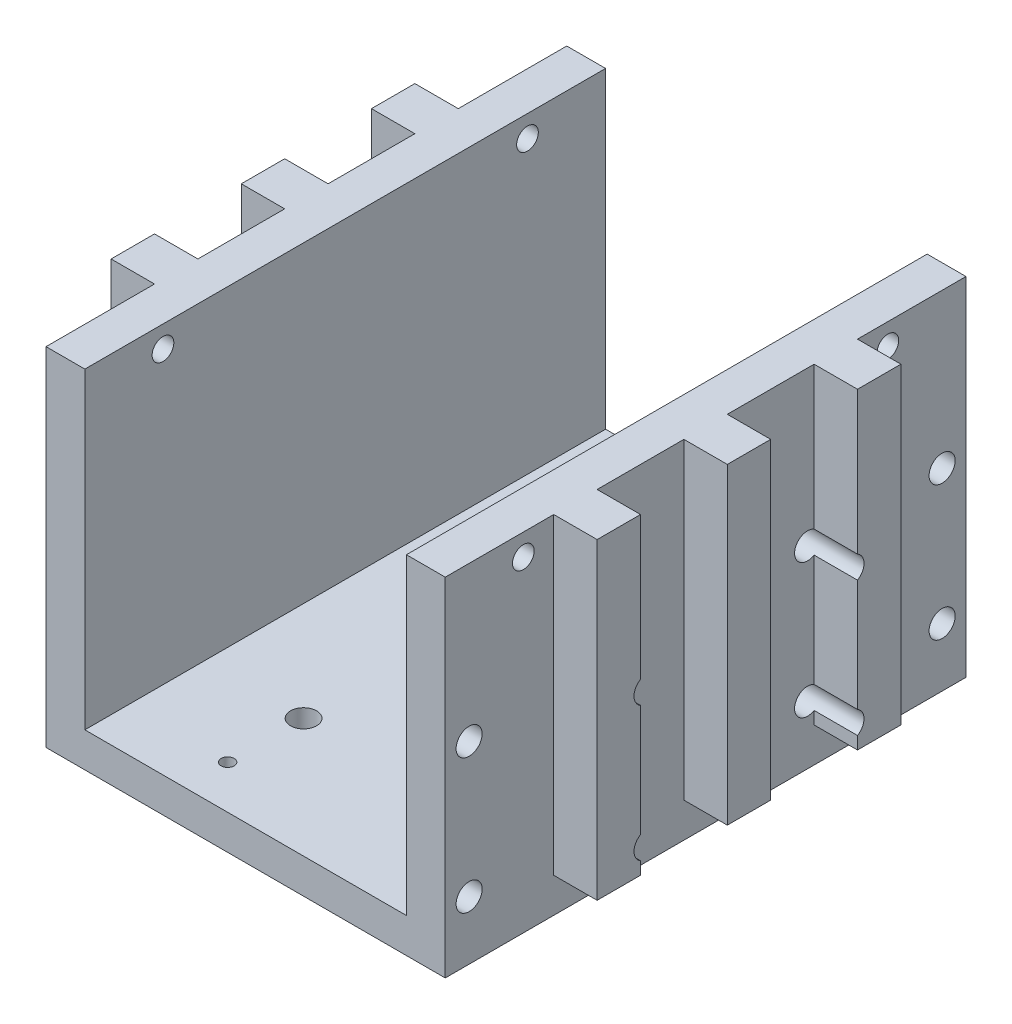
from build123d import *

# Parameters (mm, degrees)
SKETCH1_W           = 92
SKETCH1_H           = 120
BOSS_EXTRUDE1_DEPTH = 8
BOSS_EXTRUDE2_DEPTH = 72
CUT_EXTRUDE1_REACH  = 178.647
SKETCH3_R           = 3
SKETCH3_R_2         = 1.5
CUT_EXTRUDE2_REACH  = 173.635
SKETCH4_R           = 1.25
SKETCH5_R           = 3
CUT_EXTRUDE3_DEPTH  = 15
SKETCH6_R           = 2.5
CUT_EXTRUDE4_DEPTH  = 177.646539734


with BuildPart() as part:
    # Sketch1 → Boss-Extrude1 (new body)
    with BuildSketch(Plane(origin=(0, 0, 0), x_dir=(1, 0, 0), z_dir=(0, 1, 0))):
        with Locations((46, 60)):
            Rectangle(SKETCH1_W, SKETCH1_H)
    extrude(amount=BOSS_EXTRUDE1_DEPTH)

    # Sketch2 → Boss-Extrude2 (add)
    with BuildSketch(Plane(origin=(0, 8, 0), x_dir=(1, 0, 0), z_dir=(0, 1, 0))):
        Polygon((0, 120), (8.948645063, 120), (8.948645063, 0), (0, 0), (0, 25), (-10, 25), (-10, 35), (0, 35), (0, 55), (-10, 55), (-10, 65), (0, 65), (0, 85), (-10, 85), (-10, 95), (0, 95), align=None)
        Polygon((92, 55), (92, 35), (102, 35), (102, 25), (92, 25), (92, 0), (83.051354937, 0), (83.051354937, 120), (92, 120), (92, 95), (102, 95), (102, 85), (92, 85), (92, 65), (102, 65), (102, 55), align=None)
    extrude(amount=BOSS_EXTRUDE2_DEPTH)

    # Sketch3 → Cut-Extrude1 (cut, up to next)
    with BuildSketch(Plane.XZ, mode=Mode.PRIVATE) as cut_extrude1_sk1:
        with Locations((31.85, -92.5)):
            Circle(SKETCH3_R)
    cut_extrude1_tool1 = extrude(cut_extrude1_sk1.sketch, amount=-CUT_EXTRUDE1_REACH, mode=Mode.PRIVATE) & part.part
    # Sketch3 → Cut-Extrude1 (cut, up to next)
    with BuildSketch(Plane.XZ, mode=Mode.PRIVATE) as cut_extrude1_sk2:
        with Locations((31.85, -110)):
            Circle(SKETCH3_R_2)
    cut_extrude1_tool2 = extrude(cut_extrude1_sk2.sketch, amount=-CUT_EXTRUDE1_REACH, mode=Mode.PRIVATE) & part.part
    # Sketch3 → Cut-Extrude1 (cut, up to next)
    with BuildSketch(Plane.XZ, mode=Mode.PRIVATE) as cut_extrude1_sk3:
        with Locations((31.85, -10)):
            Circle(SKETCH3_R_2)
    cut_extrude1_tool3 = extrude(cut_extrude1_sk3.sketch, amount=-CUT_EXTRUDE1_REACH, mode=Mode.PRIVATE) & part.part
    # Sketch3 → Cut-Extrude1 (cut, up to next)
    with BuildSketch(Plane.XZ, mode=Mode.PRIVATE) as cut_extrude1_sk4:
        with Locations((31.85, -27.5)):
            Circle(SKETCH3_R)
    cut_extrude1_tool4 = extrude(cut_extrude1_sk4.sketch, amount=-CUT_EXTRUDE1_REACH, mode=Mode.PRIVATE) & part.part
    add(cut_extrude1_tool1.solids().sort_by_distance((31.85, 0, -92.5))[0], mode=Mode.SUBTRACT)
    add(cut_extrude1_tool2.solids().sort_by_distance((31.85, 0, -110))[0], mode=Mode.SUBTRACT)
    add(cut_extrude1_tool3.solids().sort_by_distance((31.85, 0, -10))[0], mode=Mode.SUBTRACT)
    add(cut_extrude1_tool4.solids().sort_by_distance((31.85, 0, -27.5))[0], mode=Mode.SUBTRACT)

    # Sketch4 → Cut-Extrude2 (cut, up to next)
    with BuildSketch(Plane.ZY.offset(-83.051354937), mode=Mode.PRIVATE) as cut_extrude2_sk1:
        with Locations((-114.5, 13.5)):
            Circle(SKETCH4_R)
    cut_extrude2_tool1 = extrude(cut_extrude2_sk1.sketch, amount=-CUT_EXTRUDE2_REACH, mode=Mode.PRIVATE) & part.part
    # Sketch4 → Cut-Extrude2 (cut, up to next)
    with BuildSketch(Plane.ZY.offset(-83.051354937), mode=Mode.PRIVATE) as cut_extrude2_sk2:
        with Locations((-114.5, 44.5)):
            Circle(SKETCH4_R)
    cut_extrude2_tool2 = extrude(cut_extrude2_sk2.sketch, amount=-CUT_EXTRUDE2_REACH, mode=Mode.PRIVATE) & part.part
    # Sketch4 → Cut-Extrude2 (cut, up to next)
    with BuildSketch(Plane.ZY.offset(-83.051354937), mode=Mode.PRIVATE) as cut_extrude2_sk3:
        with Locations((-83.5, 44.5)):
            Circle(SKETCH4_R)
    cut_extrude2_tool3 = extrude(cut_extrude2_sk3.sketch, amount=-CUT_EXTRUDE2_REACH, mode=Mode.PRIVATE) & part.part
    # Sketch4 → Cut-Extrude2 (cut, up to next)
    with BuildSketch(Plane.ZY.offset(-83.051354937), mode=Mode.PRIVATE) as cut_extrude2_sk4:
        with Locations((-83.5, 13.5)):
            Circle(SKETCH4_R)
    cut_extrude2_tool4 = extrude(cut_extrude2_sk4.sketch, amount=-CUT_EXTRUDE2_REACH, mode=Mode.PRIVATE) & part.part
    # Sketch4 → Cut-Extrude2 (cut, up to next)
    with BuildSketch(Plane.ZY.offset(-83.051354937), mode=Mode.PRIVATE) as cut_extrude2_sk5:
        with Locations((-36.5, 44.5)):
            Circle(SKETCH4_R)
    cut_extrude2_tool5 = extrude(cut_extrude2_sk5.sketch, amount=-CUT_EXTRUDE2_REACH, mode=Mode.PRIVATE) & part.part
    # Sketch4 → Cut-Extrude2 (cut, up to next)
    with BuildSketch(Plane.ZY.offset(-83.051354937), mode=Mode.PRIVATE) as cut_extrude2_sk6:
        with Locations((-5.5, 44.5)):
            Circle(SKETCH4_R)
    cut_extrude2_tool6 = extrude(cut_extrude2_sk6.sketch, amount=-CUT_EXTRUDE2_REACH, mode=Mode.PRIVATE) & part.part
    # Sketch4 → Cut-Extrude2 (cut, up to next)
    with BuildSketch(Plane.ZY.offset(-83.051354937), mode=Mode.PRIVATE) as cut_extrude2_sk7:
        with Locations((-36.5, 13.5)):
            Circle(SKETCH4_R)
    cut_extrude2_tool7 = extrude(cut_extrude2_sk7.sketch, amount=-CUT_EXTRUDE2_REACH, mode=Mode.PRIVATE) & part.part
    # Sketch4 → Cut-Extrude2 (cut, up to next)
    with BuildSketch(Plane.ZY.offset(-83.051354937), mode=Mode.PRIVATE) as cut_extrude2_sk8:
        with Locations((-5.5, 13.5)):
            Circle(SKETCH4_R)
    cut_extrude2_tool8 = extrude(cut_extrude2_sk8.sketch, amount=-CUT_EXTRUDE2_REACH, mode=Mode.PRIVATE) & part.part
    add(cut_extrude2_tool1.solids().sort_by_distance((83.051355, 13.5, -114.5))[0], mode=Mode.SUBTRACT)
    add(cut_extrude2_tool2.solids().sort_by_distance((83.051355, 44.5, -114.5))[0], mode=Mode.SUBTRACT)
    add(cut_extrude2_tool3.solids().sort_by_distance((83.051355, 44.5, -83.5))[0], mode=Mode.SUBTRACT)
    add(cut_extrude2_tool4.solids().sort_by_distance((83.051355, 13.5, -83.5))[0], mode=Mode.SUBTRACT)
    add(cut_extrude2_tool5.solids().sort_by_distance((83.051355, 44.5, -36.5))[0], mode=Mode.SUBTRACT)
    add(cut_extrude2_tool6.solids().sort_by_distance((83.051355, 44.5, -5.5))[0], mode=Mode.SUBTRACT)
    add(cut_extrude2_tool7.solids().sort_by_distance((83.051355, 13.5, -36.5))[0], mode=Mode.SUBTRACT)
    add(cut_extrude2_tool8.solids().sort_by_distance((83.051355, 13.5, -5.5))[0], mode=Mode.SUBTRACT)

    # Sketch5 → Cut-Extrude3 (cut)
    with BuildSketch(Plane(origin=(102, 0, 0), x_dir=(0, 0, -1), z_dir=(1, 0, 0))):
        with Locations((5.5, 44.5)):
            Circle(SKETCH5_R)
        with Locations((36.5, 44.5)):
            Circle(SKETCH5_R)
        with Locations((83.5, 44.5)):
            Circle(SKETCH5_R)
        with Locations((114.5, 44.5)):
            Circle(SKETCH5_R)
        with Locations((114.5, 13.5)):
            Circle(SKETCH5_R)
        with Locations((83.5, 13.5)):
            Circle(SKETCH5_R)
        with Locations((36.5, 13.5)):
            Circle(SKETCH5_R)
        with Locations((5.5, 13.5)):
            Circle(SKETCH5_R)
    extrude(amount=-CUT_EXTRUDE3_DEPTH, mode=Mode.SUBTRACT)

    # Sketch6 → Cut-Extrude4 (cut, through all)
    with BuildSketch(Plane(origin=(92, 0, 0), x_dir=(0, 0, -1), z_dir=(1, 0, 0))):
        with Locations((18, 75)):
            Circle(SKETCH6_R)
        with Locations((102, 75)):
            Circle(SKETCH6_R)
    extrude(amount=-CUT_EXTRUDE4_DEPTH, mode=Mode.SUBTRACT)


solid = part.part
